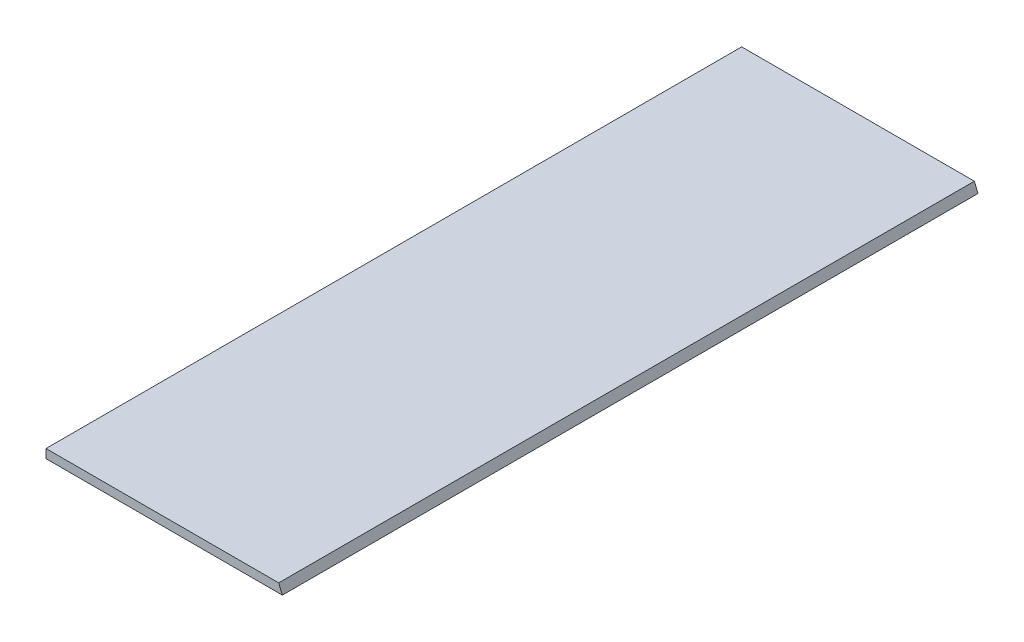
from build123d import *

# Parameters (mm, degrees)
BOSS_EXTRUDE1_DEPTH = 501.65


with BuildPart() as part:
    # Sketch1 → Boss-Extrude1 (new body)
    with BuildSketch(Plane.XY):
        Polygon((0, 0), (0, 6.35), (167.803743879, 6.35), (170.434, 0), align=None)
    extrude(amount=BOSS_EXTRUDE1_DEPTH)


solid = part.part
